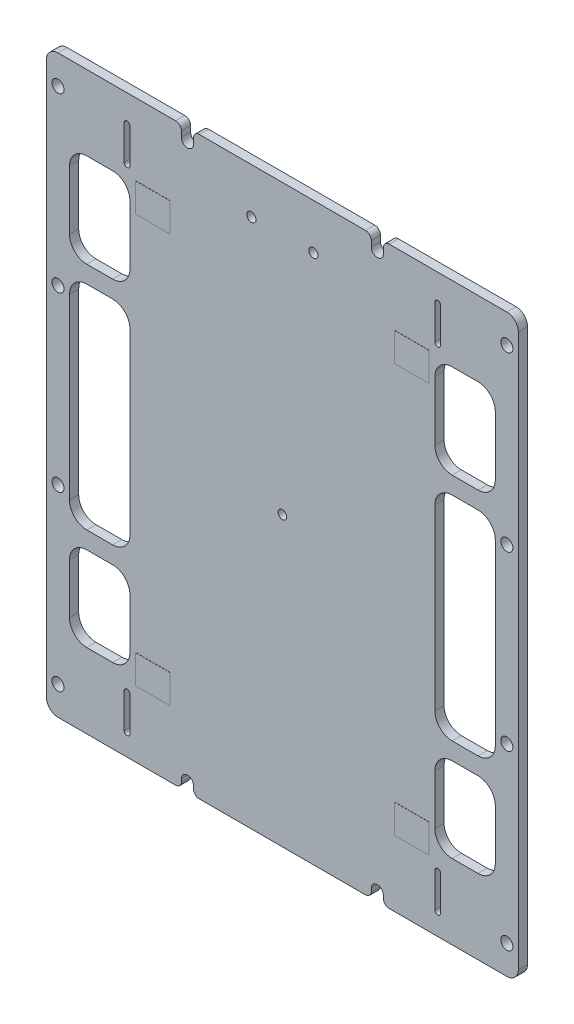
from build123d import *

# Parameters (mm, degrees)
BOARDOUTLINE_DEPTH          = 1.6
SKETCH2_R                   = 0.75
SKETCH2_R_2                 = 0.8
COMPONENTHOLES_DEPTH        = 65.680445267
SOLARCELLCONTACTHOLES_DEPTH = 1.6
WINDOWS_1SIDE_DEPTH         = 65.680445267
SKETCH5_W                   = 6
SKETCH5_H                   = 5
CONTACTPADS_DEPTH           = 0.02
M2_CLEARANCE_HOLE1_D        = 2.1
CUT_EXTRUDE1_DEPTH          = 65.680943098
FILLET3_R                   = 1
FILLET3_OF_MIRROR1_R        = 1


with BuildPart() as part:
    # Sketch1 → boardOutline (new body)
    with BuildSketch(Plane.XY):
        with BuildLine():
            Line((-39, -50), (39, -50))
            ThreePointArc((39, -50), (40.414213562, -49.414213562), (41, -48))
            Line((41, -48), (41, 48))
            ThreePointArc((41, 48), (40.414213562, 49.414213562), (39, 50))
            Line((39, 50), (-39, 50))
            ThreePointArc((-39, 50), (-40.414213562, 49.414213562), (-41, 48))
            Line((-41, 48), (-41, -48))
            ThreePointArc((-41, -48), (-40.414213562, -49.414213562), (-39, -50))
        make_face()
    extrude(amount=BOARDOUTLINE_DEPTH)

    # Sketch2 → componentHoles (cut, through all)
    with BuildSketch(Plane.XY.offset(1.6)):
        Circle(SKETCH2_R)
        with Locations((-5.385, 42.1)):
            Circle(SKETCH2_R_2)
        with Locations((5.385, 42.1)):
            Circle(SKETCH2_R_2)
    extrude(amount=-COMPONENTHOLES_DEPTH, mode=Mode.SUBTRACT)

    # Sketch4 → solarCellContactHoles (cut)
    with BuildSketch(Plane.XY.offset(1.6)):
        with BuildLine():
            Line((-27.5, 39.25), (-27.5, 45.25))
            ThreePointArc((-27.5, 45.25), (-27, 45.75), (-26.5, 45.25))
            Line((-26.5, 45.25), (-26.5, 39.25))
            ThreePointArc((-26.5, 39.25), (-27, 38.75), (-27.5, 39.25))
        make_face()
        with BuildLine():
            Line((26.5, 39.25), (26.5, 45.25))
            ThreePointArc((26.5, 45.25), (27, 45.75), (27.5, 45.25))
            Line((27.5, 45.25), (27.5, 39.25))
            ThreePointArc((27.5, 39.25), (27, 38.75), (26.5, 39.25))
        make_face()
        with BuildLine():
            Line((26.5, -46.25), (26.5, -40.25))
            ThreePointArc((26.5, -40.25), (27, -39.75), (27.5, -40.25))
            Line((27.5, -40.25), (27.5, -46.25))
            ThreePointArc((27.5, -46.25), (27, -46.75), (26.5, -46.25))
        make_face()
        with BuildLine():
            Line((-27.5, -46.25), (-27.5, -40.25))
            ThreePointArc((-27.5, -40.25), (-27, -39.75), (-26.5, -40.25))
            Line((-26.5, -40.25), (-26.5, -46.25))
            ThreePointArc((-26.5, -46.25), (-27, -46.75), (-27.5, -46.25))
        make_face()
    extrude(amount=-SOLARCELLCONTACTHOLES_DEPTH, mode=Mode.SUBTRACT)

    # Sketch3 → windows_1side (cut, through all)
    with BuildSketch(Plane.XY.offset(1.6)):
        with BuildLine():
            Line((-34, 37), (-29.5, 37))
            ThreePointArc((-29.5, 37), (-27.378679656, 36.121320344), (-26.5, 34))
            Line((-26.5, 34), (-26.5, 23.7))
            ThreePointArc((-26.5, 23.7), (-27.378679656, 21.578679656), (-29.5, 20.7))
            Line((-29.5, 20.7), (-34, 20.7))
            ThreePointArc((-34, 20.7), (-36.121320344, 21.578679656), (-37, 23.7))
            Line((-37, 23.7), (-37, 34))
            ThreePointArc((-37, 34), (-36.121320344, 36.121320344), (-34, 37))
        make_face()
        with BuildLine():
            Line((-29.5, -22.3), (-34, -22.3))
            ThreePointArc((-34, -22.3), (-36.121320344, -23.178679656), (-37, -25.3))
            Line((-37, -25.3), (-37, -34))
            ThreePointArc((-37, -34), (-36.121320344, -36.121320344), (-34, -37))
            Line((-34, -37), (-29.5, -37))
            ThreePointArc((-29.5, -37), (-27.378679656, -36.121320344), (-26.5, -34))
            Line((-26.5, -34), (-26.5, -25.3))
            ThreePointArc((-26.5, -25.3), (-27.378679656, -23.178679656), (-29.5, -22.3))
        make_face()
        with BuildLine():
            Line((-29.5, -19.3), (-34, -19.3))
            ThreePointArc((-34, -19.3), (-36.121320344, -18.421320344), (-37, -16.3))
            Line((-37, -16.3), (-37, 14.7))
            ThreePointArc((-37, 14.7), (-36.121320344, 16.821320344), (-34, 17.7))
            Line((-34, 17.7), (-29.5, 17.7))
            ThreePointArc((-29.5, 17.7), (-27.378679656, 16.821320344), (-26.5, 14.7))
            Line((-26.5, 14.7), (-26.5, -16.3))
            ThreePointArc((-26.5, -16.3), (-27.378679656, -18.421320344), (-29.5, -19.3))
        make_face()
    windows_1side = extrude(amount=-WINDOWS_1SIDE_DEPTH, mode=Mode.SUBTRACT)

    # Sketch5 → contactPads (add)
    with BuildSketch(Plane.XY.offset(1.6)):
        with Locations((-22.5, 35)):
            Rectangle(SKETCH5_W, SKETCH5_H)
        with Locations((22.5, 35)):
            Rectangle(SKETCH5_W, SKETCH5_H)
        with Locations((22.5, -36)):
            Rectangle(SKETCH5_W, SKETCH5_H)
        with Locations((-22.5, -36)):
            Rectangle(SKETCH5_W, SKETCH5_H)
    extrude(amount=CONTACTPADS_DEPTH)

    # M2 Clearance Hole1 (through all)
    with Locations(Plane(origin=(0, 0, 0), x_dir=(-1, 0, 0), z_dir=(0, 0, -1))):
        with Locations((39, 45), (39, -15), (39, -45), (39, 15)):
            m2_clearance_hole1 = Hole(M2_CLEARANCE_HOLE1_D / 2)

    # Sketch10 → Cut-Extrude1 (cut, symmetric)
    with BuildSketch(Plane(origin=(0, 0, 0), x_dir=(-1, 0, 0), z_dir=(0, 0, -1))):
        with BuildLine():
            Line((15.45, 48), (15.45, 55.073166109))
            ThreePointArc((15.45, 55.073166109), (16.5, 56.123166109), (17.55, 55.073166109))
            Line((17.55, 55.073166109), (17.55, 48))
            ThreePointArc((17.55, 48), (16.5, 46.95), (15.45, 48))
        make_face()
        with BuildLine():
            Line((17.55, -48.5), (17.55, -55.573166109))
            ThreePointArc((17.55, -55.573166109), (16.5, -56.623166109), (15.45, -55.573166109))
            Line((15.45, -55.573166109), (15.45, -48.5))
            ThreePointArc((15.45, -48.5), (16.5, -47.45), (17.55, -48.5))
        make_face()
    cut_extrude1 = extrude(amount=CUT_EXTRUDE1_DEPTH, both=True, mode=Mode.SUBTRACT)

    # Fillet3
    fillet3_edges = [part.edges().sort_by_distance(p)[0] for p in [
        (-17.55, 50, 0.8),
        (-15.45, 50, 0.8),
        (-15.45, -50, 0.8),
        (-17.55, -50, 0.8),
    ]]
    fillet(fillet3_edges, radius=FILLET3_R)

    # Mirror1: windows_1side, M2 Clearance Hole1, Cut-Extrude1 across plane
    add(windows_1side.mirror(Plane(origin=(0, 0, 0), x_dir=(0, 0, 1), z_dir=(1, 0, 0))), mode=Mode.SUBTRACT)
    add(m2_clearance_hole1.mirror(Plane(origin=(0, 0, 0), x_dir=(0, 0, 1), z_dir=(1, 0, 0))), mode=Mode.SUBTRACT)
    add(cut_extrude1.mirror(Plane(origin=(0, 0, 0), x_dir=(0, 0, 1), z_dir=(1, 0, 0))), mode=Mode.SUBTRACT)

    # Fillet3 of Mirror1
    fillet3_of_mirror1_edges = [part.edges().sort_by_distance(p)[0] for p in [
        (17.55, 50, 0.8),
        (15.45, 50, 0.8),
        (15.45, -50, 0.8),
        (17.55, -50, 0.8),
    ]]
    fillet(fillet3_of_mirror1_edges, radius=FILLET3_OF_MIRROR1_R)


solid = part.part
